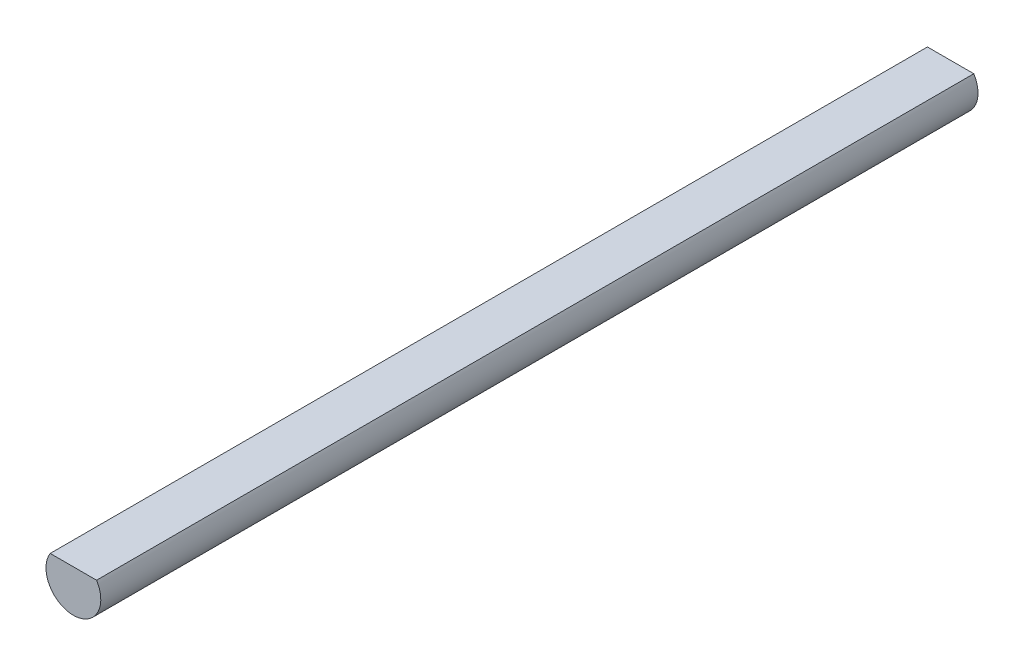
from build123d import *

# Parameters (mm, degrees)
SKETCH1_R           = 1.875
BOSS_EXTRUDE1_DEPTH = 60
CUT_EXTRUDE1_DEPTH  = 61.058565168


with BuildPart() as part:
    # Sketch1 → Boss-Extrude1 (new body)
    with BuildSketch(Plane.XY):
        Circle(SKETCH1_R)
    extrude(amount=BOSS_EXTRUDE1_DEPTH)

    # Sketch3 → Cut-Extrude1 (cut, through all)
    with BuildSketch(Plane.XY.offset(60)):
        with BuildLine():
            Line((-1.732050808, 1), (1.732050808, 1))
            ThreePointArc((1.732050808, 1), (0, 2), (-1.732050808, 1))
        make_face()
    extrude(amount=-CUT_EXTRUDE1_DEPTH, mode=Mode.SUBTRACT)


solid = part.part
